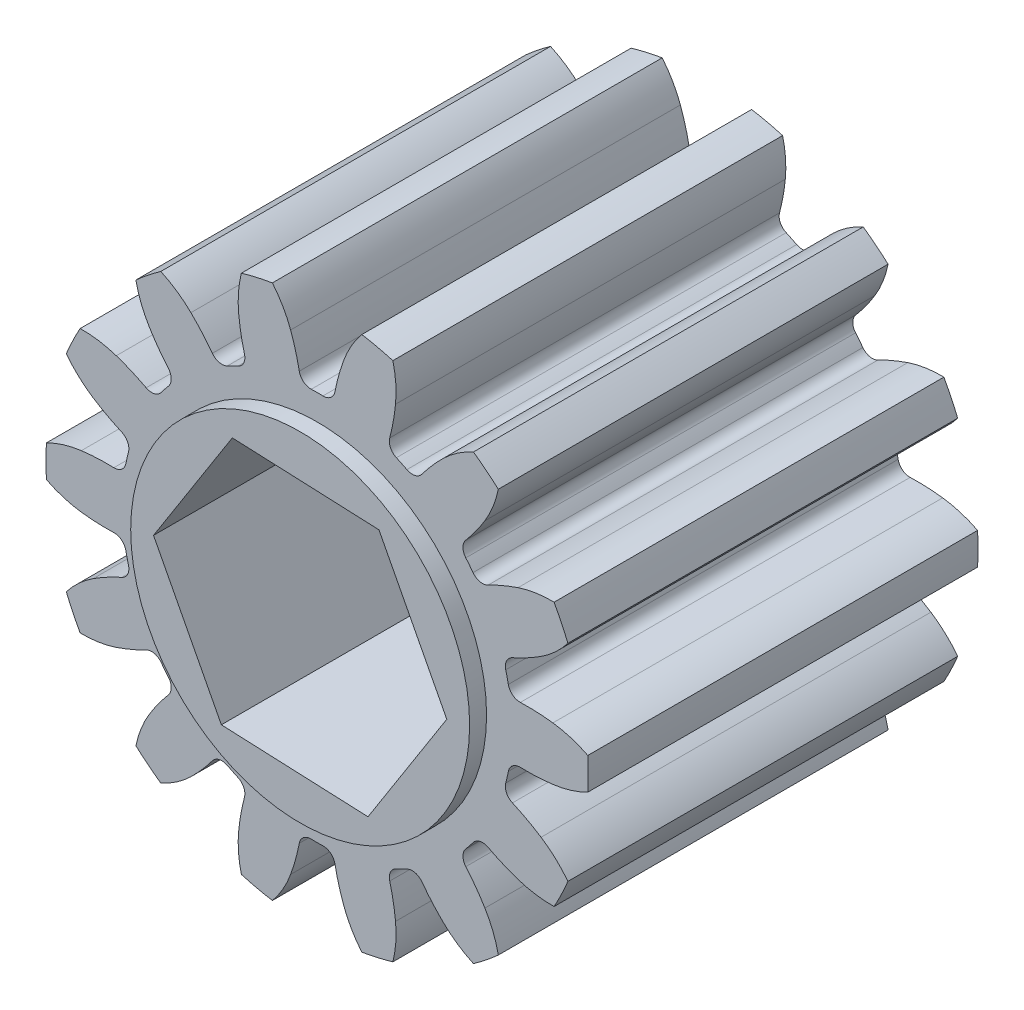
from build123d import *

# Parameters (mm, degrees)
SKETCH1_R                = 10.16
BLANK_DISK_DEPTH         = 7.3025
GEAR_TOOTH_CUT_DEPTH     = 21.487977572
GEAR_TEETH_REVOLVE_COUNT = 14
SKETCH4_R                = 6.35
EXTRUDE1_DEPTH           = 0.635
HEX_BORE_CUT_DEPTH       = 21.419327355
HEX_BORE_CUT_DEPTH_BACK  = 21.419327355


with BuildPart() as part:
    # Sketch1 → BLANK DISK (new, symmetric)
    with BuildSketch(Plane.XY):
        Circle(SKETCH1_R)
    extrude(amount=BLANK_DISK_DEPTH, both=True)

    # Sketch2 → GEAR TOOTH CUT (cut, through all)
    with BuildSketch(Plane.XY.offset(7.3025)):
        with BuildLine():
            ThreePointArc((-9.396700139, -3.863628669), (-9.905267588, -2.260812689), (-10.14249994, -0.596066244))
            ThreePointArc((-10.14249994, -0.596066244), (-9.505521324, -0.853359985), (-8.833851038, -0.997585))
            ThreePointArc((-8.833851038, -0.997585), (-8.225987275, -1.049707959), (-7.615903732, -1.053344953))
            ThreePointArc((-7.615903732, -1.053344953), (-7.324418673, -1.149517855), (-7.164754908, -1.411663328))
            ThreePointArc((-7.164754908, -1.411663328), (-7.119411079, -1.62495912), (-7.067718882, -1.836805939))
            ThreePointArc((-7.067718882, -1.836805939), (-7.097830305, -2.142266361), (-7.318721411, -2.355385779))
            ThreePointArc((-7.318721411, -2.355385779), (-7.866809657, -2.623367926), (-8.391860679, -2.934071291))
            ThreePointArc((-8.391860679, -2.934071291), (-8.934437807, -3.355440354), (-9.396700139, -3.863628669))
        make_face()
    gear_tooth_cut = extrude(amount=-GEAR_TOOTH_CUT_DEPTH, mode=Mode.SUBTRACT)

    # GEAR TEETH REVOLVE: GEAR TOOTH CUT ×14 about axis
    gear_teeth_revolve_axis = Axis((0, 0, 50), (0, 0, -1))
    for i in range(1, GEAR_TEETH_REVOLVE_COUNT):
        add(gear_tooth_cut.rotate(gear_teeth_revolve_axis, i * 360 / GEAR_TEETH_REVOLVE_COUNT), mode=Mode.SUBTRACT)

    # Sketch4 → Extrude1 (add)
    with BuildSketch(Plane.XY.offset(7.3025)):
        Circle(SKETCH4_R)
    extrude(amount=EXTRUDE1_DEPTH)

    # Sketch3 → HEX BORE CUT (cut, two sides: drawn at the far end of the back side and taken through both)
    with BuildSketch(Plane.XY.offset(7.3025).offset(-HEX_BORE_CUT_DEPTH_BACK)):
        Polygon((2.952418625, 4.639514982), (-2.541728523, 4.876627022), (-5.494147148, 0.237112041), (-2.952418625, -4.639514982), (2.541728523, -4.876627022), (5.494147148, -0.237112041), align=None)
    extrude(amount=HEX_BORE_CUT_DEPTH + HEX_BORE_CUT_DEPTH_BACK, mode=Mode.SUBTRACT)


solid = part.part
